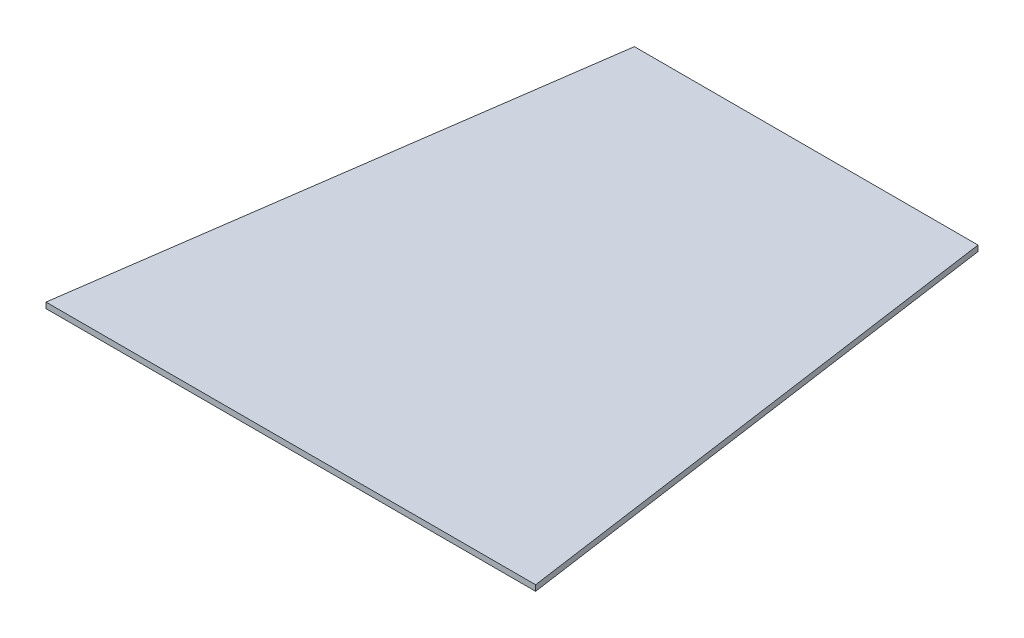
from build123d import *

# Parameters (mm, degrees)
EXTRUDE_1_DEPTH = 1


with BuildPart() as part:
    # 草图1 → 凸台-拉伸1 (new body)
    with BuildSketch(Plane(origin=(0, 0, 0), x_dir=(1, 0, 0), z_dir=(0, 1, 0))):
        Polygon((30, 90), (-30, 90), (-42.75, 0), (42.75, 0), align=None)
    extrude(amount=EXTRUDE_1_DEPTH)


solid = part.part
